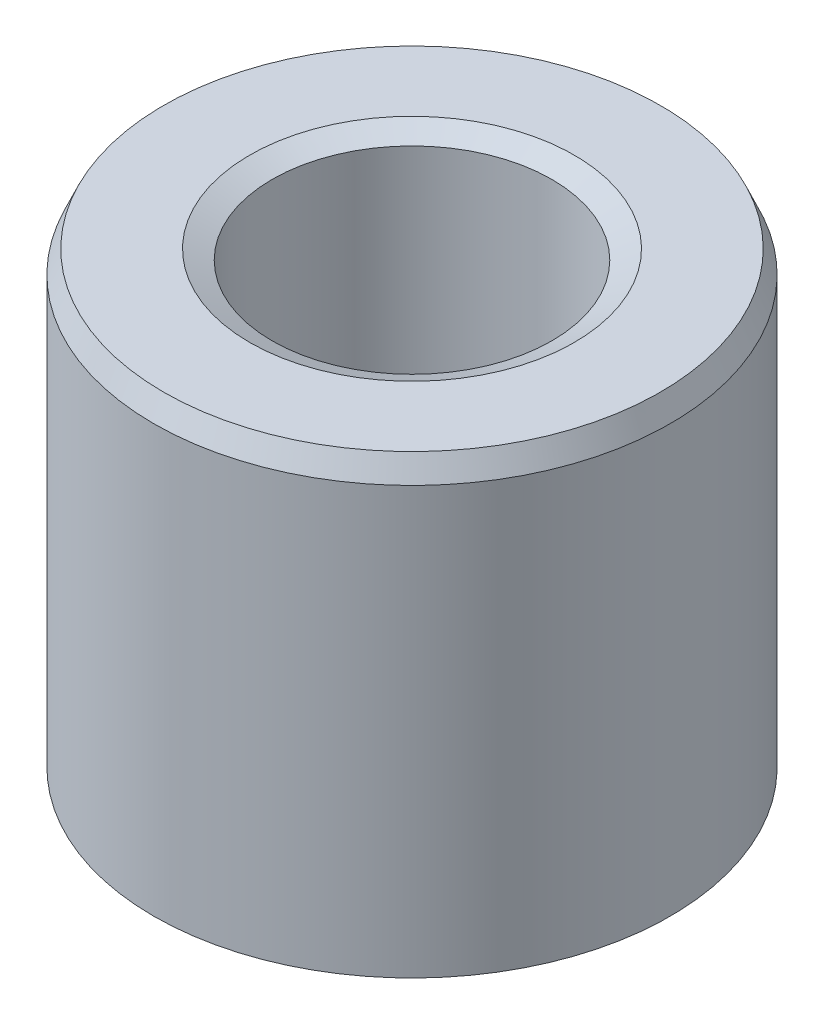
from build123d import *
from OCP.BRepFilletAPI import BRepFilletAPI_MakeChamfer

# Parameters (mm, degrees)
SKETCH1_R           = 30
BOSS_EXTRUDE1_DEPTH = 53.310525626
SKETCH2_R           = 16.252612692
CUT_EXTRUDE1_DEPTH  = 69.132313498
CHAMFER1_SIZE       = 2.604955796
CHAMFER1_SIZE2      = 1.140456332


with BuildPart() as part:
    # Sketch1 → Boss-Extrude1 (new body)
    with BuildSketch(Plane(origin=(0, 0, 0), x_dir=(1, 0, 0), z_dir=(0, 1, 0))):
        Circle(SKETCH1_R)
    extrude(amount=BOSS_EXTRUDE1_DEPTH)

    # Sketch2 → Cut-Extrude1 (cut, through all)
    with BuildSketch(Plane(origin=(0, 0, 0), x_dir=(1, 0, 0), z_dir=(0, 1, 0))):
        Circle(SKETCH2_R)
    extrude(amount=CUT_EXTRUDE1_DEPTH, mode=Mode.SUBTRACT)

    # Chamfer1: one chamfer whose edges measure the first distance from different faces: ONE call of the kernel's chamfer builder (chamfer() names one face for all edges)
    chamfer1_edges_1 = [part.edges().sort_by_distance(p)[0] for p in [
        (-16.252612692, 53.310525626, 0),
    ]]
    chamfer1_side_1 = [part.faces().sort_by_distance(p)[0] for p in [
        (-29.151471863, 53.310525626, 0),
    ]]
    chamfer1_edges_2 = [part.edges().sort_by_distance(p)[0] for p in [
        (-16.252612692, 0, 0),
    ]]
    chamfer1_side_2 = [part.faces().sort_by_distance(p)[0] for p in [
        (-16.252612692, 26.655262813, 0),
    ]]
    chamfer1_edges_3 = [part.edges().sort_by_distance(p)[0] for p in [
        (-30, 0, 0),
    ]]
    chamfer1_side_3 = [part.faces().sort_by_distance(p)[0] for p in [
        (-29.151471863, 0, 0),
    ]]
    chamfer1_edges_4 = [part.edges().sort_by_distance(p)[0] for p in [
        (-30, 53.310525626, 0),
    ]]
    chamfer1_side_4 = [part.faces().sort_by_distance(p)[0] for p in [
        (-30, 26.655262813, 0),
    ]]
    chamfer1 = BRepFilletAPI_MakeChamfer(part.part.solid().wrapped)
    for e in chamfer1_edges_1:
        chamfer1.Add(CHAMFER1_SIZE, CHAMFER1_SIZE2, e.wrapped, chamfer1_side_1[0].wrapped)  # the first distance lies on this face
    for e in chamfer1_edges_2:
        chamfer1.Add(CHAMFER1_SIZE, CHAMFER1_SIZE2, e.wrapped, chamfer1_side_2[0].wrapped)  # the first distance lies on this face
    for e in chamfer1_edges_3:
        chamfer1.Add(CHAMFER1_SIZE, CHAMFER1_SIZE2, e.wrapped, chamfer1_side_3[0].wrapped)  # the first distance lies on this face
    for e in chamfer1_edges_4:
        chamfer1.Add(CHAMFER1_SIZE, CHAMFER1_SIZE2, e.wrapped, chamfer1_side_4[0].wrapped)  # the first distance lies on this face
    add(Compound.cast(chamfer1.Shape()), mode=Mode.REPLACE)


solid = part.part
